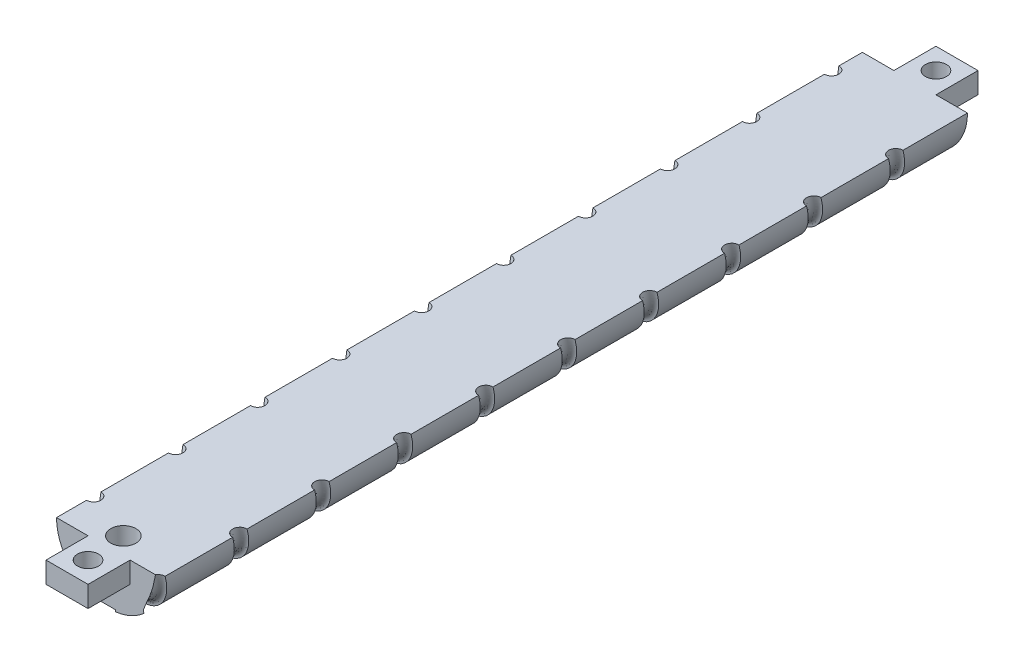
from build123d import *

# Parameters (mm, degrees)
SALIENTE_EXTRUIR1_DEPTH = 115
CORTAR_BARRER1_PITCH    = 11.7
CORTAR_EXTRUIR5_DEPTH   = 5
CROQUIS9_R              = 1.8
CORTAR_EXTRUIR6_DEPTH   = 15
CROQUIS14_R             = 1.5
SALIENTE_EXTRUIR4_DEPTH = 3


with BuildPart() as part:
    # Croquis1 → Saliente-Extruir1 (new body)
    with BuildSketch(Plane.XY):
        with BuildLine():
            Line((-74.141390006, 30.667613636), (-59.141390006, 30.667613636))
            ThreePointArc((-59.141390006, 30.667613636), (-66.641390006, 23.167613636), (-74.141390006, 30.667613636))
        make_face()
    extrude(amount=SALIENTE_EXTRUIR1_DEPTH)

    # Cortar-Barrer1: arcs per turn and ends read off the stored shape
    # Cortar-Barrer1: the profile of Croquis6 screwed along a right-hand helix through 10 turns, 16 arcs to a turn; built about Z, then put on its axis
    cortar_barrer1_z = Axis((0, 0, 0), (0, 0, 1))
    cortar_barrer1_corners = [(7.479693942, -0.240358284, 0.968086947), (8.479693942, 0.000607464, -0.002446674), (7.479693942, 0.241573212, -0.972980294), (6.479693942, 0.000607464, -0.002446674)]
    with BuildLine(mode=Mode.PRIVATE) as cortar_barrer1_profile:
        ThreePointArc((7.479693942, -0.240358284, 0.968086947), (8.186800724, -0.16978105, 0.68382423), (8.479693942, 0.000607464, -0.002446674))
        ThreePointArc((8.479693942, 0.000607464, -0.002446674), (8.186800724, 0.170995979, -0.688717578), (7.479693942, 0.241573212, -0.972980294))
        ThreePointArc((7.479693942, 0.241573212, -0.972980294), (6.772587161, 0.170995979, -0.688717578), (6.479693942, 0.000607464, -0.002446674))
        ThreePointArc((6.479693942, 0.000607464, -0.002446674), (6.772587161, -0.16978105, 0.68382423), (7.479693942, -0.240358284, 0.968086947))
    cortar_barrer1_cap = Face(cortar_barrer1_profile.wire())
    cortar_barrer1_arcs = [((7.479693942, -0.240358284, 0.968086947), (8.479693942, -0.240358284, 0.968086947), (8.479693942, 0.000607464, -0.002446674), (1, 0.7071067811865476, 1)), ((8.479693942, 0.000607464, -0.002446674), (8.479693942, 0.241573212, -0.972980294), (7.479693942, 0.241573212, -0.972980294), (1, 0.7071067811865476, 1)), ((7.479693942, 0.241573212, -0.972980294), (6.479693942, 0.241573212, -0.972980294), (6.479693942, 0.000607464, -0.002446674), (1, 0.7071067811865476, 1)), ((6.479693942, 0.000607464, -0.002446674), (6.479693942, -0.240358284, 0.968086947), (7.479693942, -0.240358284, 0.968086947), (1, 0.7071067811865476, 1))]  # start, shoulder, end, weights
    cortar_barrer1_turn_angles = [0, 11.25, 22.5, 33.75, 45, 56.25, 67.5, 78.75, 90, 101.25, 112.5, 123.75, 135, 146.25, 157.5, 168.75, 180, 191.25, 202.5, 213.75, 225, 236.25, 247.5, 258.75, 270, 281.25, 292.5, 303.75, 315, 326.25, 337.5, 348.75, 360]
    cortar_barrer1_turn_weights = [1, 0.9807852804032304, 1, 0.9807852804032304, 1, 0.9807852804032304, 1, 0.9807852804032304, 1, 0.9807852804032304, 1, 0.9807852804032304, 1, 0.9807852804032304, 1, 0.9807852804032304, 1, 0.9807852804032304, 1, 0.9807852804032304, 1, 0.9807852804032304, 1, 0.9807852804032304, 1, 0.9807852804032304, 1, 0.9807852804032304, 1, 0.9807852804032304, 1, 0.9807852804032304, 1]
    cortar_barrer1_turn_sides = [Face.make_bezier_surface([[Vector(p[j][0], p[j][1], 0).rotate(cortar_barrer1_z, cortar_barrer1_turn_angles[2 * i + k]) / cortar_barrer1_turn_weights[2 * i + k] + Vector(0, 0, p[j][2] + CORTAR_BARRER1_PITCH * cortar_barrer1_turn_angles[2 * i + k] / 360) for k in range(3)] for j in range(3)], [[p[3][j] * cortar_barrer1_turn_weights[2 * i + k] for k in range(3)] for j in range(3)]) for p in cortar_barrer1_arcs for i in range(16)]
    cortar_barrer1 = Plane(origin=(-66.641390006, 30.667613636, 0), x_dir=(0.7071067811865515, 0.7071067811865436, 0), z_dir=(0, 0, 1)) * Solid(Shell([*[p.moved(Location((0, 0, CORTAR_BARRER1_PITCH * i))) for i in range(10) for p in cortar_barrer1_turn_sides], cortar_barrer1_cap, cortar_barrer1_cap.rotate(cortar_barrer1_z, 3600).moved(Location((0, 0, CORTAR_BARRER1_PITCH * 3600 / 360)))]))
    add(cortar_barrer1, mode=Mode.SUBTRACT)

    # Croquis8 → Cortar-Extruir5 (cut)
    with BuildSketch(Plane.XY.offset(115)):
        Polygon((-67.761446488, 23.482529971), (-69.698658969, 23.482529971), (-69.698658969, 22.414809959), (-65.747222374, 22.414809959), (-65.747222374, 23.482529971), align=None)
    extrude(amount=-CORTAR_EXTRUIR5_DEPTH, mode=Mode.SUBTRACT)

    # Croquis9 → Cortar-Extruir6 (cut)
    with BuildSketch(Plane.XZ.offset(-23.482529971)):
        with Locations(Location((-67.110025481, 112.489352987, 0), (0, 0, 270))):
            Circle(CROQUIS9_R)
    extrude(amount=-CORTAR_EXTRUIR6_DEPTH, mode=Mode.SUBTRACT)

    # Croquis14 → Saliente-Extruir4 (add)
    # profile 1 of 2: a face of its own
    with BuildSketch(Plane(origin=(0, 30.667613636, 0), x_dir=(1, 0, 0), z_dir=(0, 1, 0))):
        Polygon((-66.641390006, 0), (-63.641390006, 0), (-63.641390006, 6), (-69.641390006, 6), (-69.641390006, 0), align=None)
        with Locations(Location((-66.641390006, 3, 0), (0, 0, 270))):
            Circle(CROQUIS14_R, mode=Mode.SUBTRACT)
    # profile 2 of 2: a face of its own
    with BuildSketch(Plane(origin=(0, 30.667613636, 0), x_dir=(1, 0, 0), z_dir=(0, 1, 0))):
        Polygon((-69.641390006, -115), (-66.641390006, -115), (-63.641390006, -115), (-63.641390006, -121), (-69.641390006, -121), align=None)
        with Locations(Location((-66.641390006, -118, 0), (0, 0, 90))):
            Circle(CROQUIS14_R, mode=Mode.SUBTRACT)
    extrude(amount=-SALIENTE_EXTRUIR4_DEPTH)


solid = part.part
